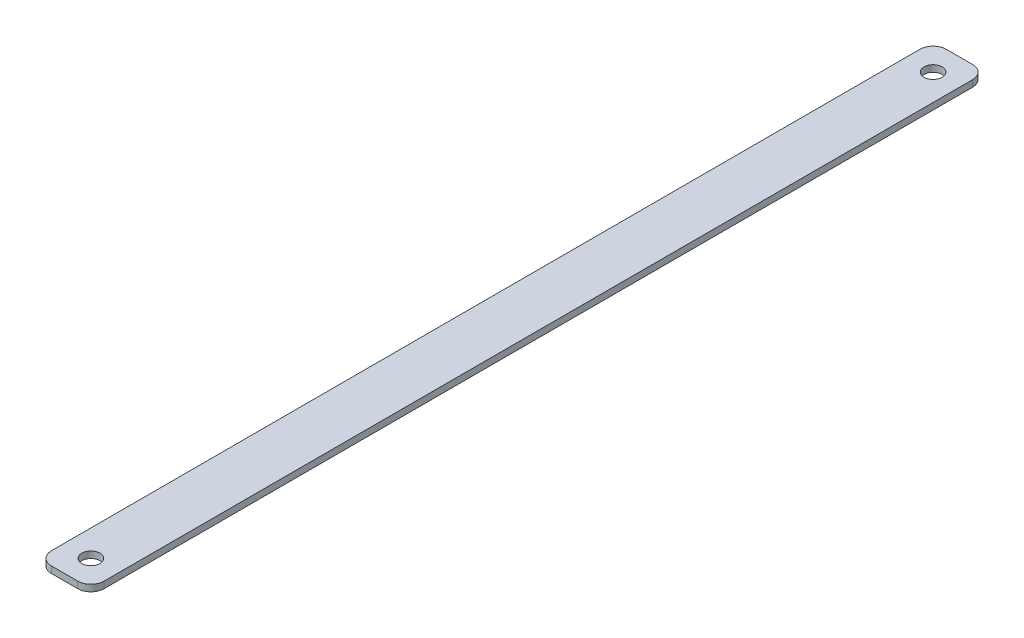
from build123d import *

# Parameters (mm, degrees)
SKETCH1_R           = 2.1828125
BOSS_EXTRUDE1_DEPTH = 0.79375


with BuildPart() as part:
    # Sketch1 → Boss-Extrude1 (new, symmetric)
    with BuildSketch(Plane(origin=(0, 0, 0), x_dir=(1, 0, 0), z_dir=(0, 1, 0))):
        with BuildLine():
            Line((3.175, 0), (9.525, 0))
            ThreePointArc((9.525, 0), (11.77006403, 0.92993597), (12.7, 3.175))
            Line((12.7, 3.175), (12.7, 212.725))
            ThreePointArc((12.7, 212.725), (11.77006403, 214.97006403), (9.525, 215.9))
            Line((9.525, 215.9), (3.175, 215.9))
            ThreePointArc((3.175, 215.9), (0.92993597, 214.97006403), (0, 212.725))
            Line((0, 212.725), (0, 3.175))
            ThreePointArc((0, 3.175), (0.92993597, 0.92993597), (3.175, 0))
        make_face()
        with Locations((6.35, 209.55)):
            Circle(SKETCH1_R, mode=Mode.SUBTRACT)
        with Locations((6.35, 6.35)):
            Circle(SKETCH1_R, mode=Mode.SUBTRACT)
    extrude(amount=BOSS_EXTRUDE1_DEPTH, both=True)


solid = part.part
